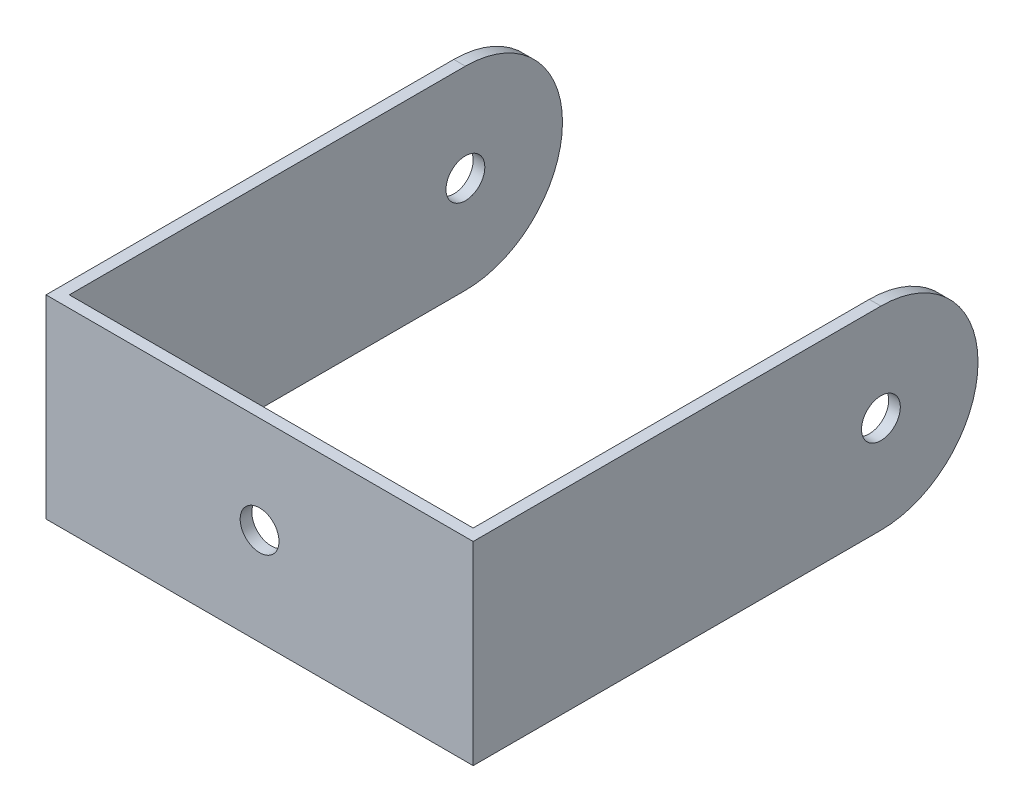
from build123d import *

# Parameters (mm, degrees)
BOSS_EXTRUDE1_DEPTH     = 12.5
FILLET1_R               = 12.5
CUT_EXTRUDE1_DEPTH      = 45.370598373
CUT_EXTRUDE1_DEPTH_BACK = 45.370598373
SKETCH2_R               = 2.5
SKETCH3_R               = 2.5
CUT_EXTRUDE2_DEPTH      = 10


with BuildPart() as part:
    # Sketch1 → Boss-Extrude1 (new, symmetric)
    with BuildSketch(Plane(origin=(0, 0, 0), x_dir=(1, 0, 0), z_dir=(0, 1, 0))):
        Polygon((26, -31), (26, 32.5), (27.5, 32.5), (27.5, -32.5), (-27.5, -32.5), (-27.5, 32.5), (-26, 32.5), (-26, -31), align=None)
    extrude(amount=BOSS_EXTRUDE1_DEPTH, both=True)

    # Fillet1
    fillet1_edges = [part.edges().sort_by_distance(p)[0] for p in [
        (-26.75, -12.5, -32.5),
        (-26.75, 12.5, -32.5),
        (26.75, -12.5, -32.5),
        (26.75, 12.5, -32.5),
    ]]
    fillet(fillet1_edges, radius=FILLET1_R - 0.0001)  # a hair under: the kernel refuses the full size

    # Sketch2 → Cut-Extrude1 (cut, two sides: drawn at the far end of the back side and taken through both)
    with BuildSketch(Plane(origin=(0, 0, 0), x_dir=(0, 0, -1), z_dir=(1, 0, 0)).offset(-CUT_EXTRUDE1_DEPTH_BACK)):
        with Locations((20, 0)):
            Circle(SKETCH2_R)
    extrude(amount=CUT_EXTRUDE1_DEPTH + CUT_EXTRUDE1_DEPTH_BACK, mode=Mode.SUBTRACT)

    # Sketch3 → Cut-Extrude2 (cut)
    with BuildSketch(Plane.XY.offset(32.5)):
        Circle(SKETCH3_R)
    extrude(amount=-CUT_EXTRUDE2_DEPTH, mode=Mode.SUBTRACT)


solid = part.part
